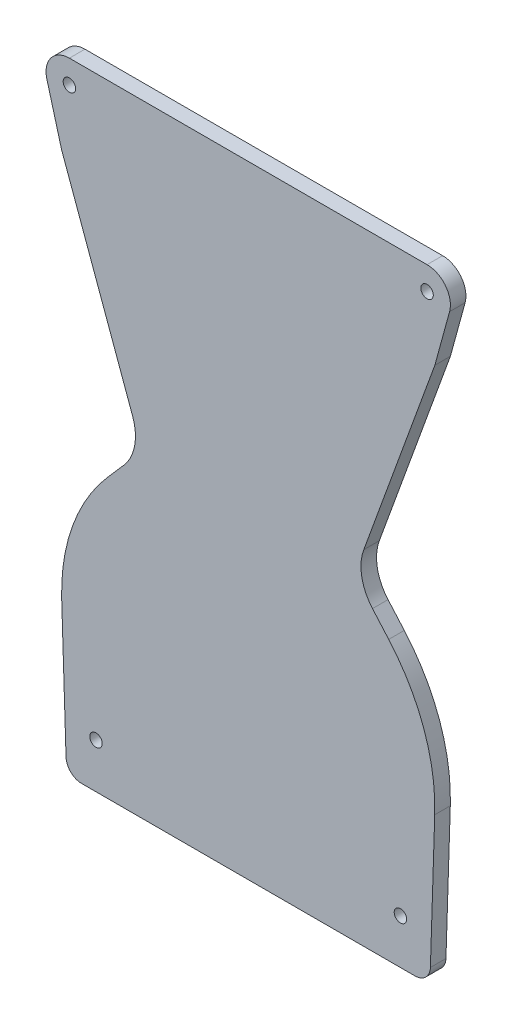
from build123d import *

# Parameters (mm, degrees)
SKETCH1_R           = 2
BOSS_EXTRUDE1_DEPTH = 5
BOSS_EXTRUDE2_DEPTH = 10
CHAMFER2_SIZE       = 10


with BuildPart() as part:
    # Sketch1 → Boss-Extrude1 (new body)
    with BuildSketch(Plane.XY):
        with BuildLine():
            Line((-39.95406266, -4.540740277), (-45.172708428, -10.510426525))
            ThreePointArc((-45.172708428, -10.510426525), (-56.503917554, -29.818144261), (-59.968772691, -51.935536587))
            Line((-59.968772691, -51.935536587), (-58.57362931, -95.161294716))
            ThreePointArc((-58.57362931, -95.161294716), (-57.054271725, -98.592107569), (-53.576231585, -100))
            Line((-53.576231585, -100), (-50, -100))
            Line((-50, -100), (50, -100))
            Line((50, -100), (53.576231585, -100))
            ThreePointArc((53.576231585, -100), (57.054271725, -98.592107569), (58.57362931, -95.161294716))
            Line((58.57362931, -95.161294716), (59.968772691, -51.935536587))
            ThreePointArc((59.968772691, -51.935536587), (56.503917554, -29.818144261), (45.172708428, -10.510426525))
            Line((45.172708428, -10.510426525), (39.95406266, -4.540740277))
            ThreePointArc((39.95406266, -4.540740277), (36.502239109, 2.577573283), (37.151850455, 10.461955241))
            Line((37.151850455, 10.461955241), (60, 73.236730193))
            Line((60, 73.236730193), (64.733567494, 90.51871221))
            ThreePointArc((64.733567494, 90.51871221), (63.462787034, 97.049194521), (57.5, 100))
            Line((57.5, 100), (55, 100))
            Line((55, 100), (-55, 100))
            Line((-55, 100), (-57.5, 100))
            ThreePointArc((-57.5, 100), (-63.462787034, 97.049194521), (-64.733567494, 90.51871221))
            Line((-64.733567494, 90.51871221), (-60, 73.236730193))
            Line((-60, 73.236730193), (-37.151850455, 10.461955241))
            ThreePointArc((-37.151850455, 10.461955241), (-36.502239109, 2.577573283), (-39.95406266, -4.540740277))
        make_face()
        with Locations((-57.5, 92.5)):
            Circle(SKETCH1_R, mode=Mode.SUBTRACT)
        with Locations((57.5, 92.5)):
            Circle(SKETCH1_R, mode=Mode.SUBTRACT)
        with Locations((48.939097244, -85.598196118)):
            Circle(SKETCH1_R, mode=Mode.SUBTRACT)
        with Locations((-48.939097244, -85.598196118)):
            Circle(SKETCH1_R, mode=Mode.SUBTRACT)
    extrude(amount=BOSS_EXTRUDE1_DEPTH)

    # Sketch2 → Boss-Extrude2 (add)
    with BuildSketch(Plane(origin=(0, 0, 0), x_dir=(-1, 0, 0), z_dir=(0, 0, -1))):
        with BuildLine():
            Line((-23.747944524, 0.5), (23.747944524, 0.5))
            ThreePointArc((23.747944524, 0.5), (23.669056818, 3.144030102), (24.253462846, 5.723872742))
            Line((24.253462846, 5.723872742), (25.870507592, 10.166666667))
            Line((25.870507592, 10.166666667), (-25.870507592, 10.166666667))
            Line((-25.870507592, 10.166666667), (-24.253462846, 5.723872742))
            ThreePointArc((-24.253462846, 5.723872742), (-23.669056818, 3.144030102), (-23.747944524, 0.5))
        make_face()
    extrude(amount=BOSS_EXTRUDE2_DEPTH)

    # Chamfer2
    # the kernel refuses this chamfer: 10 mm, written as the material it takes off along each edge
    with BuildSketch(Plane(origin=(-51.587337472, 10.166666667, -10), x_dir=(0, 0.027495876610586317, 0.9996219169112968), z_dir=(1, 0, 0))) as chamfer2_piece_1_section:
        Polygon((CHAMFER2_SIZE * 0.999621916911, CHAMFER2_SIZE * 0.0274958766106), (-CHAMFER2_SIZE * 0.0274958766106, CHAMFER2_SIZE * 0.999621916911), (0, 0), align=None)
    chamfer2_piece_1 = extrude(amount=103.174674944, mode=Mode.PRIVATE)
    chamfer2_piece_1 = split(chamfer2_piece_1, bisect_by=Plane(origin=(0, 6.862625123, 0), z_dir=(0, 0, -1)), keep=Keep.TOP, mode=Mode.PRIVATE)
    add(chamfer2_piece_1, mode=Mode.SUBTRACT)


solid = part.part
